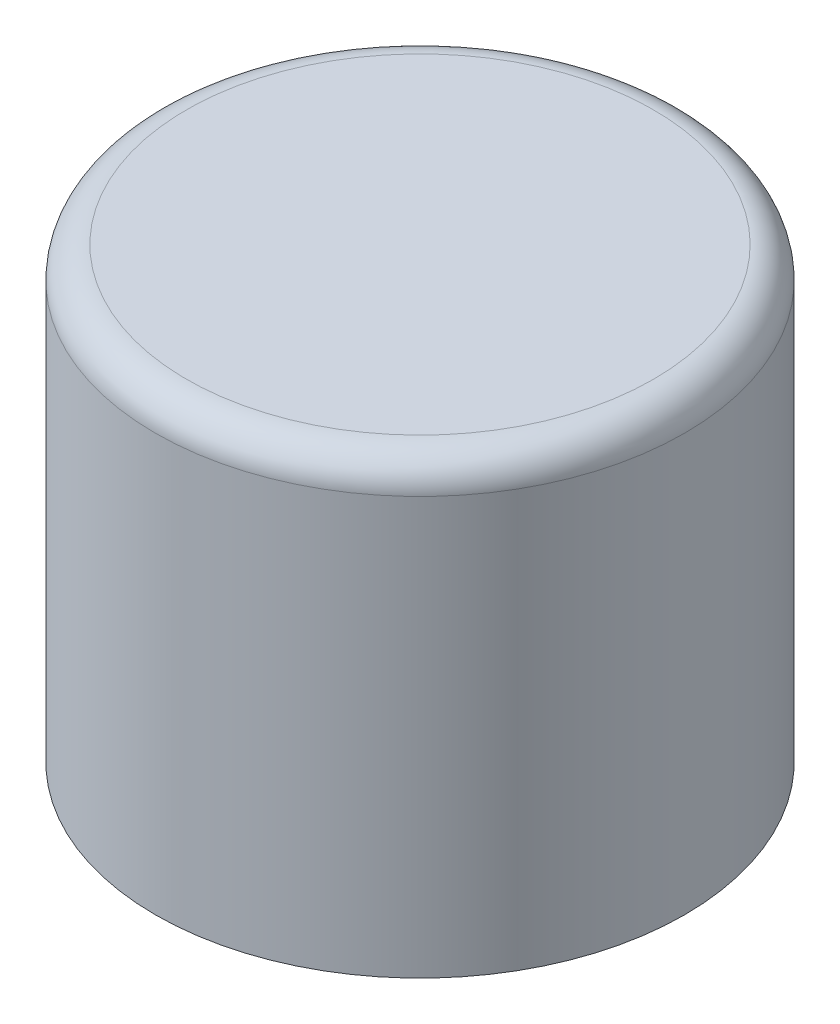
from build123d import *

# Parameters (mm, degrees)
CONG_1_R = 2


with BuildPart() as part:
    # Esquisse1 → Révolution1 (revolve)
    with BuildSketch(Plane.XY):
        Polygon((-17, 0), (-17, 28.8), (0, 28.8), (0, 25.8), (-12, 25.8), (-12, 3), (-12.5, 3), (-12.5, 2), (-12, 2), (-12, 0), align=None)
    revolve(axis=Axis((0, 0, 0), (0, 1, 0)))

    # Congé1
    cong_1_edges = [part.edges().sort_by_distance(p)[0] for p in [
        (17, 28.8, 0),
    ]]
    fillet(cong_1_edges, radius=CONG_1_R)


solid = part.part
